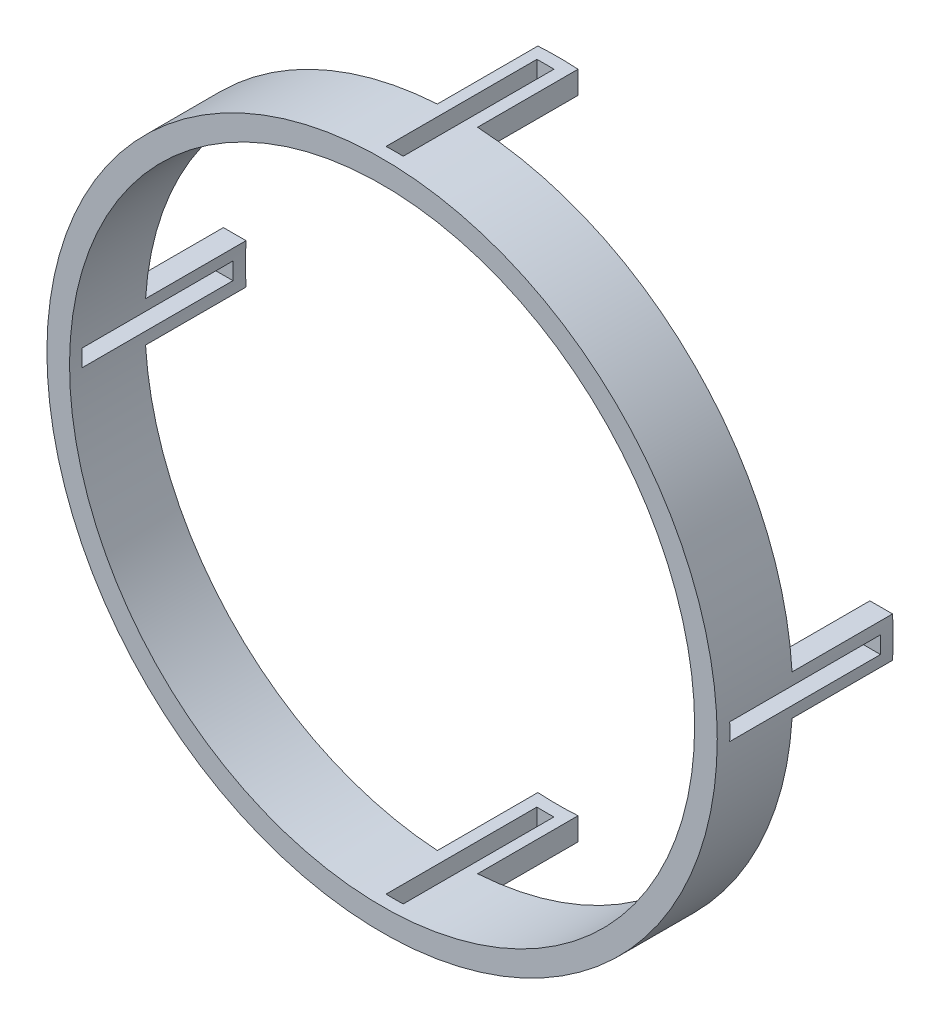
from build123d import *
from build123d.topology import SkipClean

# Parameters (mm, degrees)
SKETCH1_R           = 84.709
SKETCH1_R_2         = 78.994
BOSS_EXTRUDE1_DEPTH = 19.05
BOSS_EXTRUDE2_START = 25.4
BOSS_EXTRUDE2_DEPTH = 25.4
SKETCH2_W           = 4.318
SKETCH2_H           = 38.1
CUT_EXTRUDE1_DEPTH  = 123.459745884
CIRPATTERN1_COUNT   = 4


with BuildPart() as part:
    # Sketch1 → Boss-Extrude1 (new body)
    with BuildSketch(Plane.XY):
        Circle(SKETCH1_R)
        Circle(SKETCH1_R_2, mode=Mode.SUBTRACT)
    extrude(amount=BOSS_EXTRUDE1_DEPTH)

    # Sketch3 → Boss-Extrude2 (add)
    with SkipClean():  # the faces are left unmerged after this step: merging them gives an invalid solid
        with BuildSketch(Plane(origin=(0, 0, 0), x_dir=(-1, 0, 0), z_dir=(0, 0, -1)).offset(BOSS_EXTRUDE2_START)):
            with BuildLine():
                Line((-5.08, 78.830486717), (-5.08, 84.556538961))
                ThreePointArc((-5.08, 84.556538961), (0, 84.709), (5.08, 84.556538961))
                Line((5.08, 84.556538961), (5.08, 78.830486717))
                ThreePointArc((5.08, 78.830486717), (0, 78.994), (-5.08, 78.830486717))
            make_face()
            with BuildLine():
                Line((-5.08, -78.830486717), (-5.08, -84.556538961))
                ThreePointArc((-5.08, -84.556538961), (0, -84.709), (5.08, -84.556538961))
                Line((5.08, -84.556538961), (5.08, -78.830486717))
                ThreePointArc((5.08, -78.830486717), (0, -78.994), (-5.08, -78.830486717))
            make_face()
            with BuildLine():
                Line((78.830486717, -5.08), (84.556538961, -5.08))
                ThreePointArc((84.556538961, -5.08), (84.709, 0), (84.556538961, 5.08))
                Line((84.556538961, 5.08), (78.830486717, 5.08))
                ThreePointArc((78.830486717, 5.08), (78.994, 0), (78.830486717, -5.08))
            make_face()
            with BuildLine():
                Line((-78.830486717, 5.08), (-84.556538961, 5.08))
                ThreePointArc((-84.556538961, 5.08), (-84.709, 0), (-84.556538961, -5.08))
                Line((-84.556538961, -5.08), (-78.830486717, -5.08))
                ThreePointArc((-78.830486717, -5.08), (-78.994, 0), (-78.830486717, 5.08))
            make_face()
        extrude(amount=-BOSS_EXTRUDE2_DEPTH)

    # Sketch2 → Cut-Extrude1 (cut, through all)
    with SkipClean():  # the faces are left unmerged after this step: merging them gives an invalid solid
        with BuildSketch(Plane(origin=(0, 0, 0), x_dir=(1, 0, 0), z_dir=(0, 1, 0))):
            with Locations((0, 3.175)):
                Rectangle(SKETCH2_W, SKETCH2_H)
        cut_extrude1 = extrude(amount=-CUT_EXTRUDE1_DEPTH, mode=Mode.SUBTRACT)

    # CirPattern1: Cut-Extrude1 ×4 about axis
    with SkipClean():  # the faces are left unmerged after this step: merging them gives an invalid solid
        cirpattern1_axis = Axis((0, 0, 2.080715754), (0, 0, 1))
        for i in range(1, CIRPATTERN1_COUNT):
            add(cut_extrude1.rotate(cirpattern1_axis, i * 360 / CIRPATTERN1_COUNT), mode=Mode.SUBTRACT)


solid = part.part
